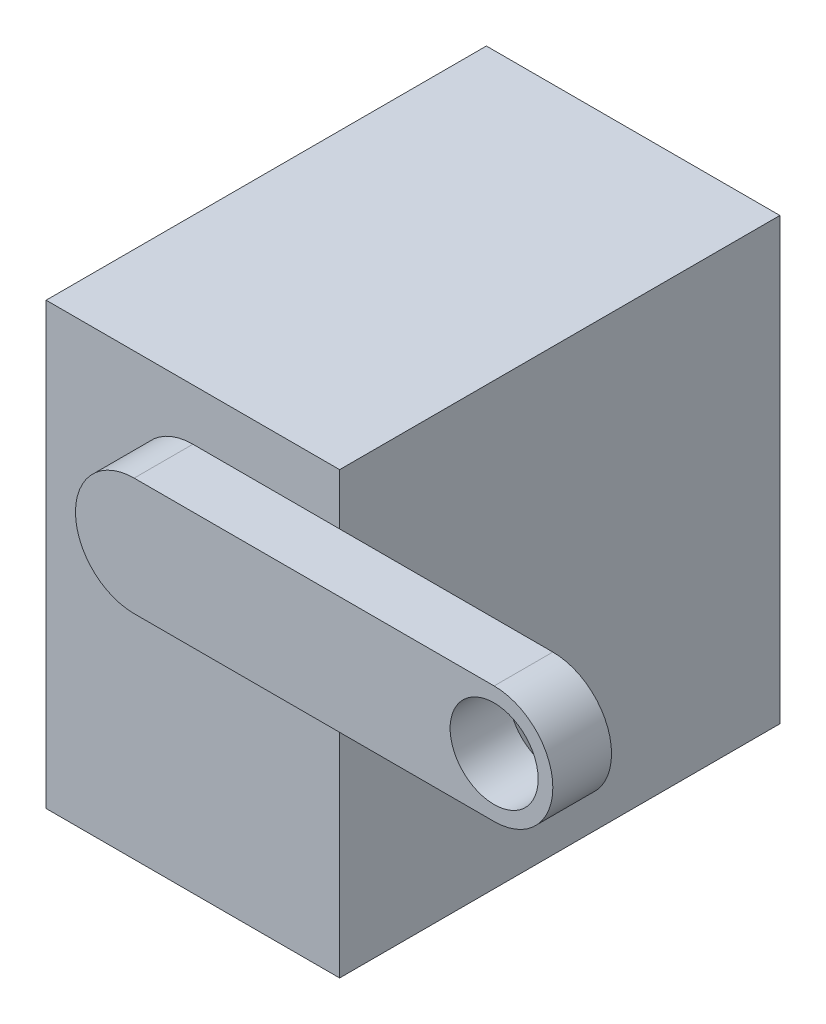
from build123d import *

# Parameters (mm, degrees)
ESQUISSE1_W        = 20
ESQUISSE1_H        = 30
BOSS_EXTRU_1_DEPTH = 30
ESQUISSE2_R        = 3
BOSS_EXTRU_2_DEPTH = 4


with BuildPart() as part:
    # Esquisse1 → Boss.-Extru.1 (new body)
    with BuildSketch(Plane.XY):
        Rectangle(ESQUISSE1_W, ESQUISSE1_H)
    extrude(amount=BOSS_EXTRU_1_DEPTH)

    # Esquisse2 → Boss.-Extru.2 (add)
    with BuildSketch(Plane.XY.offset(30)):
        with BuildLine():
            Line((0, 11.5), (24.528746791, 11.5))
            ThreePointArc((24.528746791, 11.5), (28.528746791, 7.5), (24.528746791, 3.5))
            Line((24.528746791, 3.5), (0, 3.5))
            ThreePointArc((0, 3.5), (-4, 7.5), (0, 11.5))
        make_face()
        with Locations((24.528746791, 7.5)):
            Circle(ESQUISSE2_R, mode=Mode.SUBTRACT)
    extrude(amount=BOSS_EXTRU_2_DEPTH)


solid = part.part
